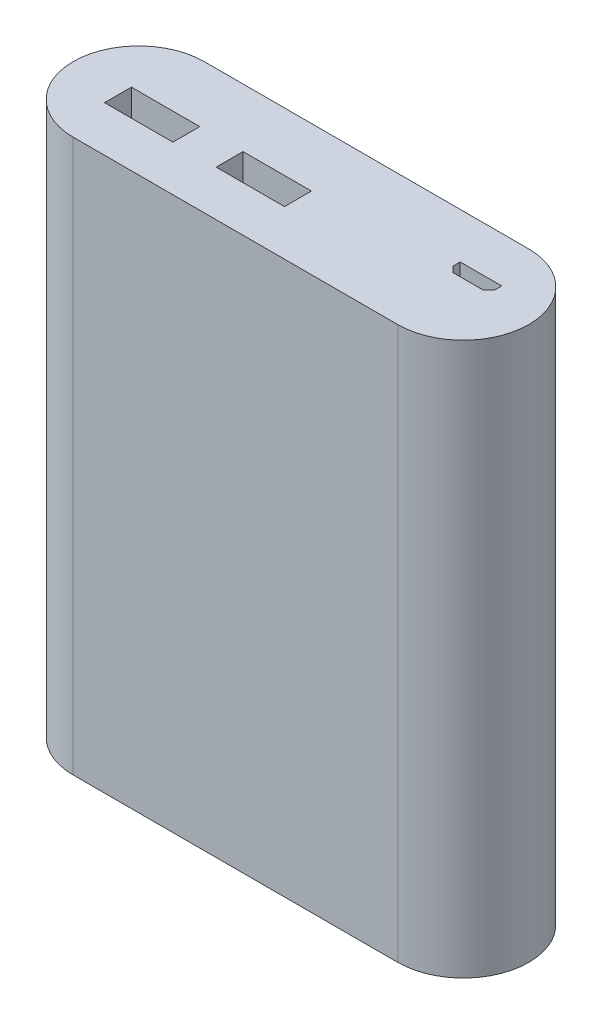
from build123d import *

# Parameters (mm, degrees)
BOSS_EXTRUDE1_DEPTH = 97
SKETCH2_W           = 12
SKETCH2_H           = 4.72
CUT_EXTRUDE1_DEPTH  = 10


with BuildPart() as part:
    # Sketch1 → Boss-Extrude1 (new body)
    with BuildSketch(Plane(origin=(0, 0, 0), x_dir=(1, 0, 0), z_dir=(0, 1, 0))):
        with BuildLine():
            Line((-28.5, 11.5), (28.5, 11.5))
            ThreePointArc((28.5, 11.5), (40, 0), (28.5, -11.5))
            Line((28.5, -11.5), (-28.5, -11.5))
            ThreePointArc((-28.5, -11.5), (-40, 0), (-28.5, 11.5))
        make_face()
    extrude(amount=BOSS_EXTRUDE1_DEPTH)

    # Sketch2 → Cut-Extrude1 (cut)
    with BuildSketch(Plane(origin=(0, 97, 0), x_dir=(1, 0, 0), z_dir=(0, 1, 0))):
        with Locations((-25, -1.14)):
            Rectangle(SKETCH2_W, SKETCH2_H)
        with Locations((-5.4, -1.14)):
            Rectangle(SKETCH2_W, SKETCH2_H)
        Polygon((25.45, 1.25), (24.45, 2.25), (24.45, 3.5), (31.75, 3.5), (31.75, 2.25), (30.75, 1.25), align=None)
    extrude(amount=-CUT_EXTRUDE1_DEPTH, mode=Mode.SUBTRACT)


solid = part.part
